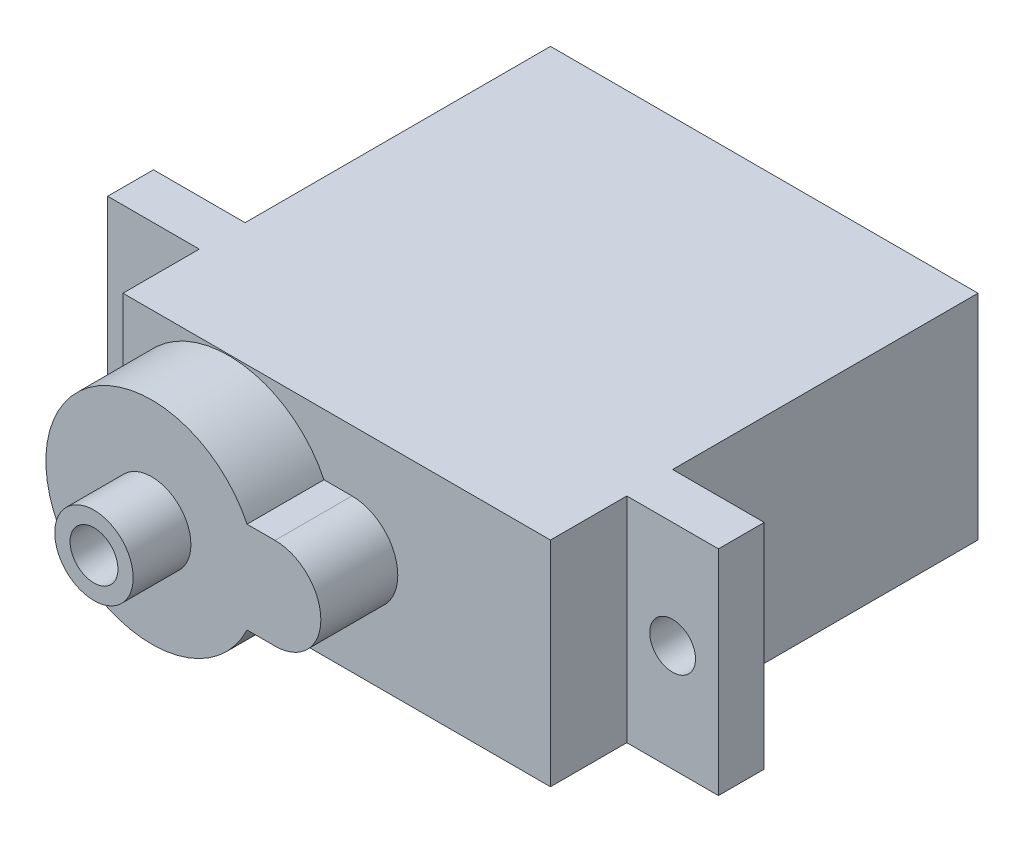
from build123d import *

# Parameters (mm, degrees)
P_IDAT_VYSUNUT_M1_DEPTH  = 5.555
P_IDAT_VYSUNUT_M2_DEPTH  = 4
SKICA3_R                 = 2.03883748
SKICA3_R_2               = 1.24519559
P_IDAT_VYSUNUT_M3_DEPTH  = 3
SKICA5_R                 = 1.190602913
SKICA5_R_2               = 1.19060243
ODEBRAT_VYSUNUT_M1_DEPTH = 23
SKICA7_W                 = 1
SKICA7_H                 = 4
P_IDAT_VYSUNUT_M4_DEPTH  = 1


# Read off the part's stored shape, not the designer's step: Přidat vysunutím2
with BuildPart() as part:
    # Skica1 → Přidat vysunutím1 (new, symmetric)
    with BuildSketch(Plane(origin=(0, 0, 0), x_dir=(1, 0, 0), z_dir=(0, 1, 0))):
        Polygon((11.32935, -15.875), (16.09185, -15.875), (16.09185, -18.25625), (11.32935, -18.25625), (11.32935, -22.225), (-10.89565, -22.225), (-10.89565, -18.25625), (-15.65815, -18.25625), (-15.65815, -15.875), (-10.89565, -15.875), (-10.89565, 0), (11.32935, 0), align=None)
    extrude(amount=P_IDAT_VYSUNUT_M1_DEPTH, both=True)

    # Přidat vysunutím2 outline → Přidat vysunutím2 (add)
    with BuildSketch(Plane.XY.offset(22.225)):
        with BuildLine():
            Line((-10.89565, 0.263816958), (-10.89565, -0.263816958))
            ThreePointArc((-10.89565, -0.263816958), (-6.494080203, -5.390484118), (-0.444197365, -2.381256561))
            Line((-0.444197365, -2.381256561), (1.010536018, -2.381256561))
            ThreePointArc((1.010536018, -2.381256561), (3.391829299, 2.729e-06), (1.010604, 2.38133))
            Line((1.010604, 2.38133), (-0.444232639, 2.38133))
            ThreePointArc((-0.444232639, 2.38133), (-6.494120128, 5.390476029), (-10.89565, 0.263816958))
        make_face()
    extrude(amount=P_IDAT_VYSUNUT_M2_DEPTH)

    # Skica3 → Přidat vysunutím3 (add)
    with BuildSketch(Plane.XY.offset(26.225)):
        with Locations((-5.401980861, 0)):
            Circle(SKICA3_R)
        with Locations((-5.401980861, 0)):
            Circle(SKICA3_R_2, mode=Mode.SUBTRACT)
    extrude(amount=P_IDAT_VYSUNUT_M3_DEPTH)

    # Skica5 → Odebrat vysunutím1 (cut)
    with BuildSketch(Plane.XY.offset(18.25625)):
        with Locations((-13.276937552, 5.8558e-05)):
            Circle(SKICA5_R)
        with Locations((13.71053658, 6.1415e-05)):
            Circle(SKICA5_R_2)
    extrude(amount=-ODEBRAT_VYSUNUT_M1_DEPTH, mode=Mode.SUBTRACT)

    # Skica7 → Přidat vysunutím4 (add)
    with BuildSketch(Plane(origin=(-10.89565, 0, 10.89565), x_dir=(0, 0, -1), z_dir=(1, 0, 0))):
        with Locations((7.39565, 0)):
            Rectangle(SKICA7_W, SKICA7_H)
    extrude(amount=-P_IDAT_VYSUNUT_M4_DEPTH)


solid = part.part
